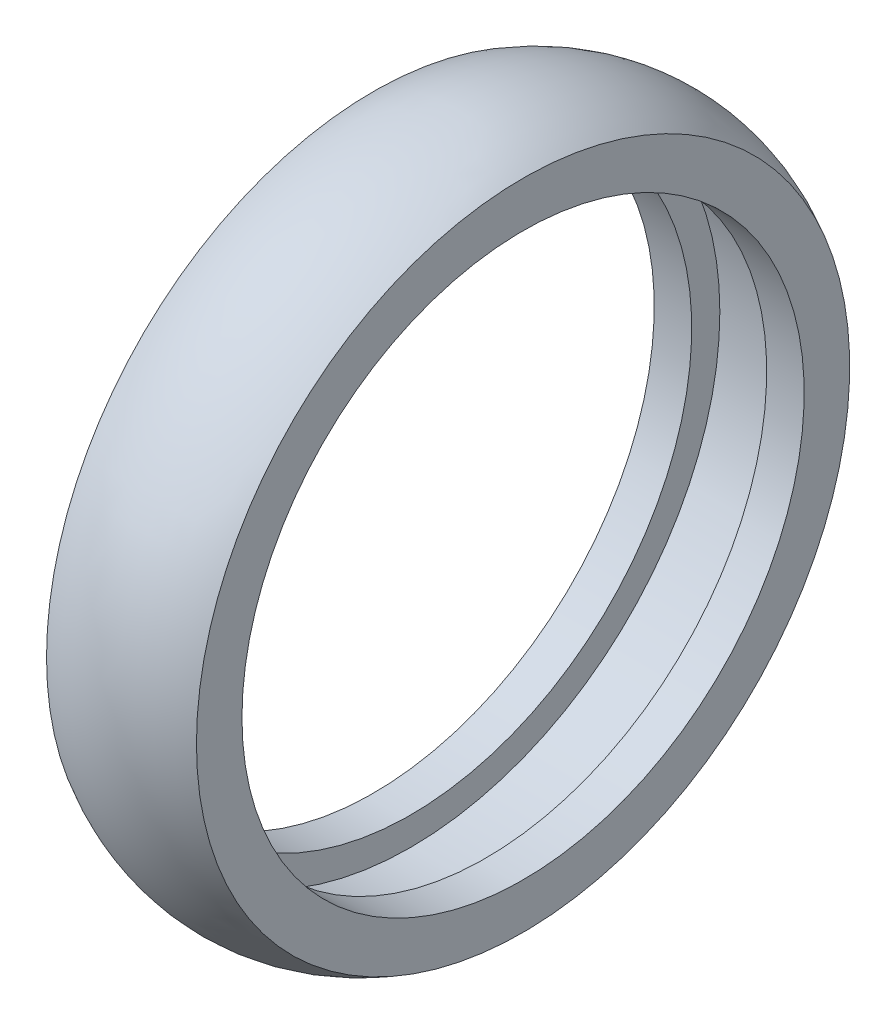
from build123d import *


with BuildPart() as part:
    # Sketch1 → Revolve1 (revolve)
    with BuildSketch(Plane.XY):
        with BuildLine():
            Line((4, 33), (-4, 33))
            Line((-4, 33), (-4, 30))
            Line((-4, 30), (-8, 30))
            Line((-8, 30), (-8, 34.856406461))
            ThreePointArc((-8, 34.856406461), (0, 37), (8, 34.856406461))
            Line((8, 34.856406461), (8, 30))
            Line((8, 30), (4, 30))
            Line((4, 30), (4, 33))
        make_face()
    revolve(axis=Axis((-690.466838324, 0, 0), (1, 0, 0)))


solid = part.part
